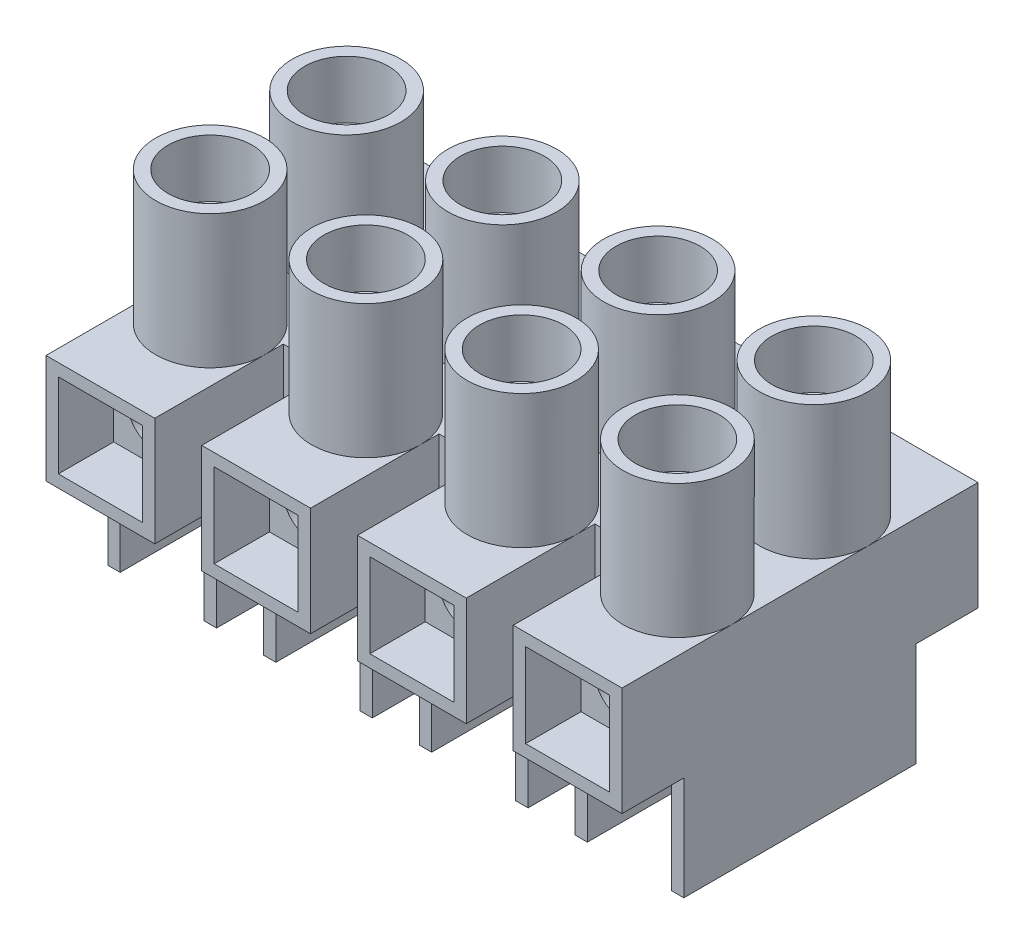
from build123d import *

# Parameters (mm, degrees)
SKETCH1_W           = 5.588
SKETCH1_H           = 5.588
BOSS_EXTRUDE1_DEPTH = 9.144
SKETCH2_R           = 2.794
BOSS_EXTRUDE2_DEPTH = 6.858
SHELL1_START        = 0.635
SHELL1_OUTLINE_R    = 2.159
SHELL1_DEPTH        = 11.811
SHELL1_2_DEPTH      = 4.318
SKETCH3_W           = 5.588
SKETCH3_H           = 5.969
BOSS_EXTRUDE3_DEPTH = 5.334
SHELL2_START        = -5.334
SHELL2_OUTLINE_W    = 4.318
SHELL2_OUTLINE_H    = 5.969
SHELL2_DEPTH        = 5.334
LPATTERN1_COUNT     = 4
LPATTERN1_PITCH     = 8.001
SKETCH5_W           = 2.413
SKETCH5_H           = 2.54
BOSS_EXTRUDE4_DEPTH = 5.588
CUT_EXTRUDE1_START  = -34.378779681
SKETCH7_R           = 1.4986
CUT_EXTRUDE1_DEPTH  = 39.966779681
LPATTERN2_COUNT     = 3
LPATTERN2_PITCH     = 8.001
LPATTERN2_2_COUNT   = 3
LPATTERN2_2_PITCH   = 8.001
SKETCH8_W           = 4.2164
SKETCH8_H           = 4.2164
SKETCH8_R           = 1.397
BOSS_EXTRUDE5_DEPTH = 6.35
LPATTERN3_COUNT     = 4
LPATTERN3_PITCH     = 8.001
SKETCH9_R           = 1.5875
BOSS_EXTRUDE6_DEPTH = 1.524
BOSS_EXTRUDE6_DRAFT = -15
SKETCH10_W          = 3.991709138
SKETCH10_H          = 0.508
CUT_EXTRUDE2_DEPTH  = 0.508
SKETCH11_R          = 1.143
BOSS_EXTRUDE7_DEPTH = 3.81
LPATTERN4_COUNT     = 4
LPATTERN4_PITCH     = 8.001
LPATTERN4_2_COUNT   = 2
LPATTERN4_2_PITCH   = 7.0104


# Read off the part's stored shape, not the designer's step: Shell1, Shell2
with BuildPart() as part:
    # Sketch1 → Boss-Extrude1 (new body)
    with BuildSketch(Plane.XY):
        with Locations((2.794, 2.794)):
            Rectangle(SKETCH1_W, SKETCH1_H)
    extrude(amount=BOSS_EXTRUDE1_DEPTH)

    # Sketch2 → Boss-Extrude2 (add)
    with BuildSketch(Plane(origin=(0, 5.588, 0), x_dir=(1, 0, 0), z_dir=(0, 1, 0))):
        with Locations(Location((2.794, -3.5052, 0), (0, 0, 180))):
            Circle(SKETCH2_R)
    extrude(amount=BOSS_EXTRUDE2_DEPTH)

    # Shell1 outline → Shell1 (cut)
    with BuildSketch(Plane(origin=(0, 0, 0), x_dir=(1, 0, 0), z_dir=(0, 1, 0)).offset(SHELL1_START)):
        with Locations((2.794, -3.5052)):
            Circle(SHELL1_OUTLINE_R)
    extrude(amount=SHELL1_DEPTH, mode=Mode.SUBTRACT)

    # Shell1 2 outline → Shell1 2 (cut)
    with BuildSketch(Plane(origin=(0, 0, 0), x_dir=(1, 0, 0), z_dir=(0, 1, 0)).offset(SHELL1_START)):
        with BuildLine():
            Line((0.635, -3.5052), (0.635, -9.144))
            Line((0.635, -9.144), (4.953, -9.144))
            Line((4.953, -9.144), (4.953, -3.5052))
            ThreePointArc((4.953, -3.5052), (2.794, -5.6642), (0.635, -3.5052))
        make_face()
        with BuildLine():
            Line((0.635, 0), (0.635, -3.5052))
            ThreePointArc((0.635, -3.5052), (2.794, -1.3462), (4.953, -3.5052))
            Line((4.953, -3.5052), (4.953, 0))
            Line((4.953, 0), (0.635, 0))
        make_face()
    extrude(amount=SHELL1_2_DEPTH, mode=Mode.SUBTRACT)

    # Sketch3 → Boss-Extrude3 (add)
    with BuildSketch(Plane.XZ):
        with Locations((2.794, 2.9845)):
            Rectangle(SKETCH3_W, SKETCH3_H)
    extrude(amount=BOSS_EXTRUDE3_DEPTH)

    # Shell2 outline → Shell2 (cut)
    with BuildSketch(Plane(origin=(0, 0, 0), x_dir=(1, 0, 0), z_dir=(0, 1, 0)).offset(SHELL2_START)):
        with Locations((2.794, -2.9845)):
            Rectangle(SHELL2_OUTLINE_W, SHELL2_OUTLINE_H)
    extrude(amount=SHELL2_DEPTH, mode=Mode.SUBTRACT)


with BuildPart() as lpattern1_1:
    # LPattern1: pattern copy
    add(part.part.moved(Location(Vector(1, 0, 0) * (1 * LPATTERN1_PITCH))))


with BuildPart() as lpattern1_2:
    # LPattern1: pattern copy
    add(part.part.moved(Location(Vector(1, 0, 0) * (2 * LPATTERN1_PITCH))))


with BuildPart() as lpattern1_3:
    # LPattern1: pattern copy
    add(part.part.moved(Location(Vector(1, 0, 0) * (3 * LPATTERN1_PITCH))))


with BuildPart() as part_1:
    add(part.part)

    add(lpattern1_1.part)  # Boss-Extrude4 merges LPattern1_1
    # Sketch5 → Boss-Extrude4 (add)
    with BuildSketch(Plane(origin=(0, 0, 0), x_dir=(1, 0, 0), z_dir=(0, 1, 0))):
        with Locations((6.7945, -1.27)):
            Rectangle(SKETCH5_W, SKETCH5_H)
    boss_extrude4 = extrude(amount=BOSS_EXTRUDE4_DEPTH)

    # Sketch7 → Cut-Extrude1 (cut)
    with BuildSketch(Plane(origin=(0, 0, 0), x_dir=(1, 0, 0), z_dir=(0, 1, 0)).offset(CUT_EXTRUDE1_START)):
        with Locations((6.7945, 0)):
            Circle(SKETCH7_R)
    cut_extrude1 = extrude(amount=CUT_EXTRUDE1_DEPTH, mode=Mode.SUBTRACT)

    add(lpattern1_2.part)  # LPattern2 merges LPattern1_2

    add(lpattern1_3.part)  # LPattern2 merges LPattern1_3
    # LPattern2: Boss-Extrude4 ×3
    with Locations(*[(i * LPATTERN2_PITCH, 0, 0) for i in range(1, LPATTERN2_COUNT)]):
        add(boss_extrude4)

    # LPattern2 2: Cut-Extrude1 ×3
    with Locations(*[(i * LPATTERN2_2_PITCH, 0, 0) for i in range(1, LPATTERN2_2_COUNT)]):
        add(cut_extrude1, mode=Mode.SUBTRACT)

    # Mirror1: part across plane


with BuildPart() as part_2:
    add(part_1.part)
    add(part_1.part.mirror(Plane.XY))


with BuildPart() as body_2:
    # Sketch8 → Boss-Extrude5 (new body)
    with BuildSketch(Plane.XY):
        with Locations((2.794, 2.794)):
            Rectangle(SKETCH8_W, SKETCH8_H)
        with Locations((2.794, 2.794)):
            Circle(SKETCH8_R, mode=Mode.SUBTRACT)
    extrude(amount=BOSS_EXTRUDE5_DEPTH)

    # Mirror2: body 2 across plane


with BuildPart() as body_2_1:
    add(body_2.part)
    add(body_2.part.mirror(Plane.XY))


with BuildPart() as lpattern3_1:
    # LPattern3: pattern copy
    add(body_2_1.part.moved(Location(Vector(1, 0, 0) * (1 * LPATTERN3_PITCH))))


with BuildPart() as lpattern3_2:
    # LPattern3: pattern copy
    add(body_2_1.part.moved(Location(Vector(1, 0, 0) * (2 * LPATTERN3_PITCH))))


with BuildPart() as lpattern3_3:
    # LPattern3: pattern copy
    add(body_2_1.part.moved(Location(Vector(1, 0, 0) * (3 * LPATTERN3_PITCH))))


with BuildPart() as body_6:
    # Sketch9 → Boss-Extrude6 (with draft: the straight prism first)
    with BuildSketch(Plane(origin=(0, 8.0772, 0), x_dir=(1, 0, 0), z_dir=(0, 1, 0))):
        with Locations((2.794, -3.5052)):
            Circle(SKETCH9_R)
    extrude(amount=BOSS_EXTRUDE6_DEPTH)
    # Boss-Extrude6: the draft: its side faces are tilted about the plane it starts from
    boss_extrude6_sides = [body_6.faces().sort_by_distance(p)[0] for p in [
        (1.2065, 8.8392, 3.5052),
    ]]
    draft(boss_extrude6_sides, Plane(origin=(0, 8.0772, 0), x_dir=(1, 0, 0), z_dir=(0, 1, 0)), BOSS_EXTRUDE6_DRAFT)

    # Sketch10 → Cut-Extrude2 (cut)
    with BuildSketch(Plane(origin=(0, 9.6012, 0), x_dir=(1, 0, 0), z_dir=(0, 1, 0))):
        with Locations((2.794, -3.5052)):
            Rectangle(SKETCH10_W, SKETCH10_H)
    extrude(amount=-CUT_EXTRUDE2_DEPTH, mode=Mode.SUBTRACT)

    # Sketch11 → Boss-Extrude7 (add)
    with BuildSketch(Plane.XZ.offset(-8.0772)):
        with Locations(Location((2.794, 3.5052, 0), (0, 0, 90))):
            Circle(SKETCH11_R)
    extrude(amount=BOSS_EXTRUDE7_DEPTH)


with BuildPart() as lpattern4_1:
    # LPattern4: pattern copy
    add(body_6.part.moved(Location(Vector(1, 0, 0) * (1 * LPATTERN4_PITCH))))


with BuildPart() as lpattern4_2:
    # LPattern4: pattern copy
    add(body_6.part.moved(Location(Vector(1, 0, 0) * (2 * LPATTERN4_PITCH))))


with BuildPart() as lpattern4_3:
    # LPattern4: pattern copy
    add(body_6.part.moved(Location(Vector(1, 0, 0) * (3 * LPATTERN4_PITCH))))


with BuildPart() as lpattern4_2_1:
    # LPattern4 2: pattern copy
    add(body_6.part.moved(Location(Vector(0, 0, -1) * (1 * LPATTERN4_2_PITCH))))


with BuildPart() as lpattern4_2_2:
    # LPattern4 2: pattern copy
    add(lpattern4_1.part.moved(Location(Vector(0, 0, -1) * (1 * LPATTERN4_2_PITCH))))


with BuildPart() as lpattern4_2_3:
    # LPattern4 2: pattern copy
    add(lpattern4_2.part.moved(Location(Vector(0, 0, -1) * (1 * LPATTERN4_2_PITCH))))


with BuildPart() as lpattern4_2_4:
    # LPattern4 2: pattern copy
    add(lpattern4_3.part.moved(Location(Vector(0, 0, -1) * (1 * LPATTERN4_2_PITCH))))


solid = Compound([part_2.part, body_2_1.part, lpattern3_1.part, lpattern3_2.part, lpattern3_3.part, body_6.part, lpattern4_1.part, lpattern4_2.part, lpattern4_3.part, lpattern4_2_1.part, lpattern4_2_2.part, lpattern4_2_3.part, lpattern4_2_4.part])
